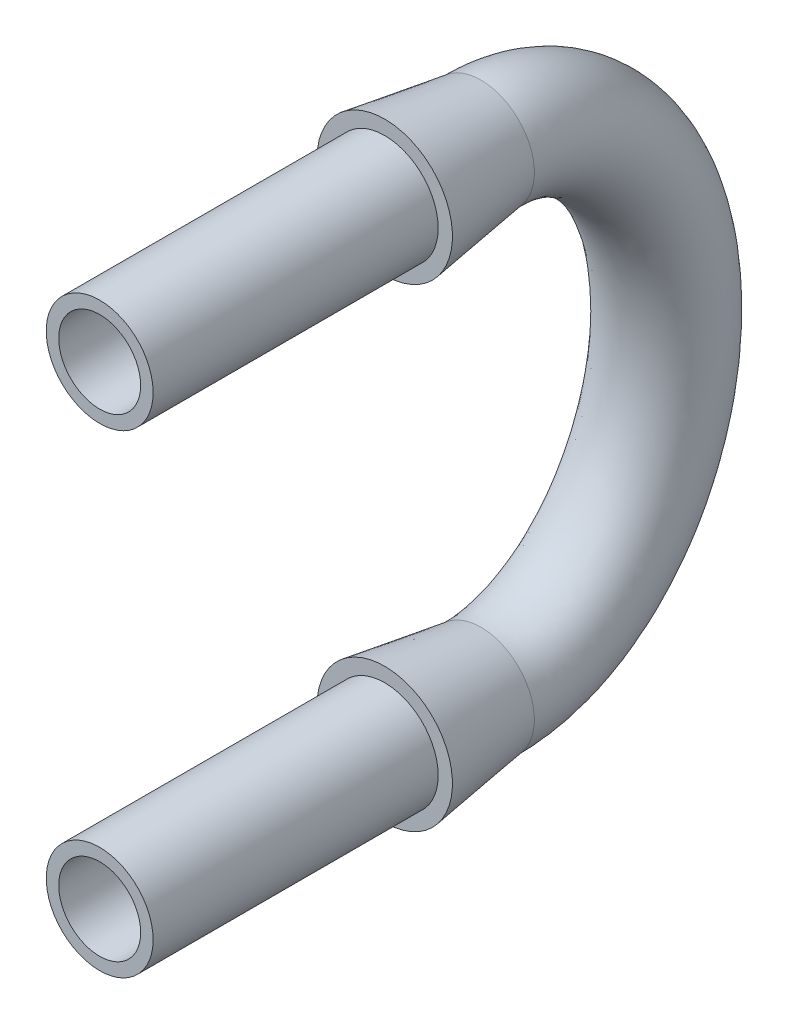
from build123d import *

# Parameters (mm, degrees)
SKETCH1_R           = 7.5
SKETCH1_R_2         = 5.75
BOSS_EXTRUDE3_DEPTH = 43.5
SKETCH7_R           = 7.5
SKETCH7_R_2         = 5.75
BOSS_EXTRUDE4_START = 10
SKETCH10_R          = 7.5
SKETCH10_R_2        = 5.75
BOSS_EXTRUDE4_DEPTH = 10


with BuildPart() as part:
    # Sketch1 → Boss-Extrude3 (new body)
    with BuildSketch(Plane.XY):
        Circle(SKETCH1_R)
        Circle(SKETCH1_R_2, mode=Mode.SUBTRACT)
    extrude(amount=-BOSS_EXTRUDE3_DEPTH)

    # Sketch4 → Revolve1 (revolve)
    with BuildSketch(Plane(origin=(0, 0, 0), x_dir=(0, 0, -1), z_dir=(1, 0, 0))):
        Polygon((43.5, 7.5), (30, 7.5), (30, 9.5), align=None)
    revolve(axis=Axis((0, 0, -43.5), (0, 0, 1)))


with BuildPart() as body_2:
    # Mirror5: mirrored copy
    add(part.part.mirror(Plane(origin=(0, 33.25, 0), x_dir=(0, 0, 1), z_dir=(0, -1, 0))))


with BuildPart() as part_1:
    add(part.part)

    add(body_2.part)  # Sweep13 merges body 2
    # Sweep13: sweep along a path in Sketch8
    with BuildLine() as sweep13_path:  # in the path sketch's own coordinates; laid on its plane below (add() does not lay a ready-made edge on the line's plane)
        add(Edge.make_bspline(
            [(43.5, 0), (69.5, 0), (69.5, 33.25), (69.5, 66.5), (43.5, 66.5)],
            knots=[0, 0, 0, 1.570796327, 1.570796327, 3.141592654, 3.141592654, 3.141592654], degree=2, weights=[1, 0.707106781, 1, 0.707106781, 1]))
    # Sketch7 → Sweep13 (sweep)
    with BuildSketch(Plane(origin=(0, 0, -43.5), x_dir=(-1, 0, 0), z_dir=(0, 0, -1))):
        Circle(SKETCH7_R)
        Circle(SKETCH7_R_2, mode=Mode.SUBTRACT)
    sweep(path=Plane(origin=(0, 0, 0), x_dir=(0, 0, -1), z_dir=(1, 0, 0)) * sweep13_path.line)

    # Sketch10 → Boss-Extrude4 (add)
    # profile 1 of 2: a face of its own
    with BuildSketch(Plane.XY.offset(BOSS_EXTRUDE4_START)):
        Circle(SKETCH10_R)
        Circle(SKETCH10_R_2, mode=Mode.SUBTRACT)
    # profile 2 of 2: a face of its own
    with BuildSketch(Plane.XY.offset(BOSS_EXTRUDE4_START)):
        with Locations((0, 66.5)):
            Circle(SKETCH10_R)
        with Locations((0, 66.5)):
            Circle(SKETCH10_R_2, mode=Mode.SUBTRACT)
    extrude(amount=-BOSS_EXTRUDE4_DEPTH)


solid = part_1.part
